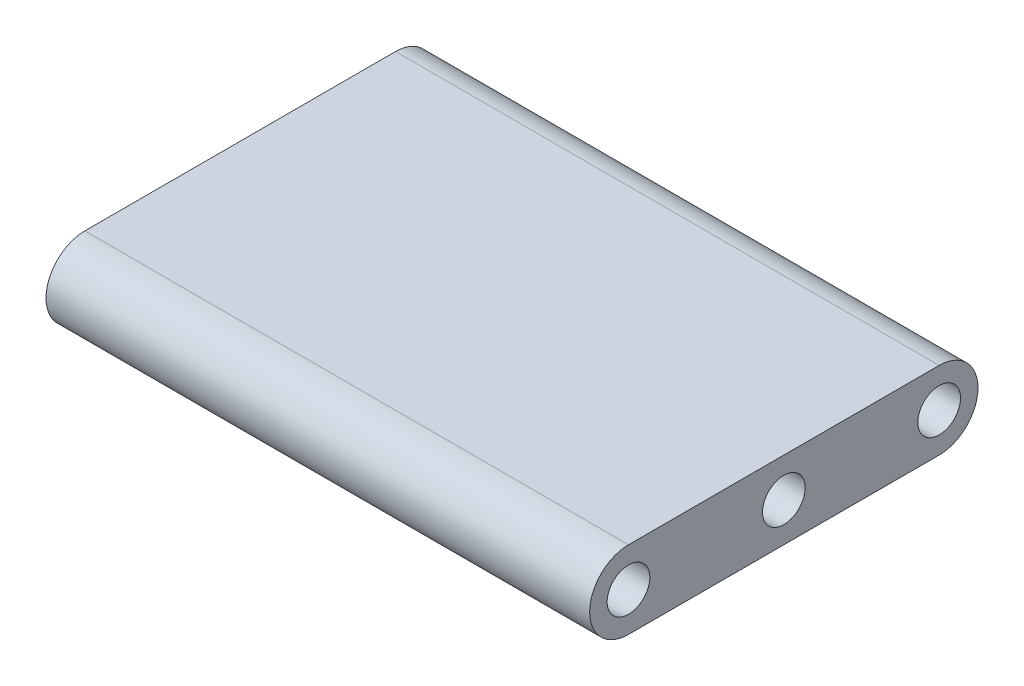
from build123d import *

# Parameters (mm, degrees)
SKETCH1_R           = 3.4925
BOSS_EXTRUDE1_DEPTH = 44.45


with BuildPart() as part:
    # Sketch1 → Boss-Extrude1 (new, symmetric)
    with BuildSketch(Plane(origin=(0, 0, 0), x_dir=(0, 0, -1), z_dir=(1, 0, 0))):
        with BuildLine():
            ThreePointArc((-25.4, 6.35), (-31.75, 0), (-25.4, -6.35))
            Line((-25.4, -6.35), (25.4, -6.35))
            ThreePointArc((25.4, -6.35), (31.75, 0), (25.4, 6.35))
            Line((25.4, 6.35), (-25.4, 6.35))
        make_face()
        with Locations((-25.4, 0)):
            Circle(SKETCH1_R, mode=Mode.SUBTRACT)
        Circle(SKETCH1_R, mode=Mode.SUBTRACT)
        with Locations((25.4, 0)):
            Circle(SKETCH1_R, mode=Mode.SUBTRACT)
    extrude(amount=BOSS_EXTRUDE1_DEPTH, both=True)


solid = part.part
